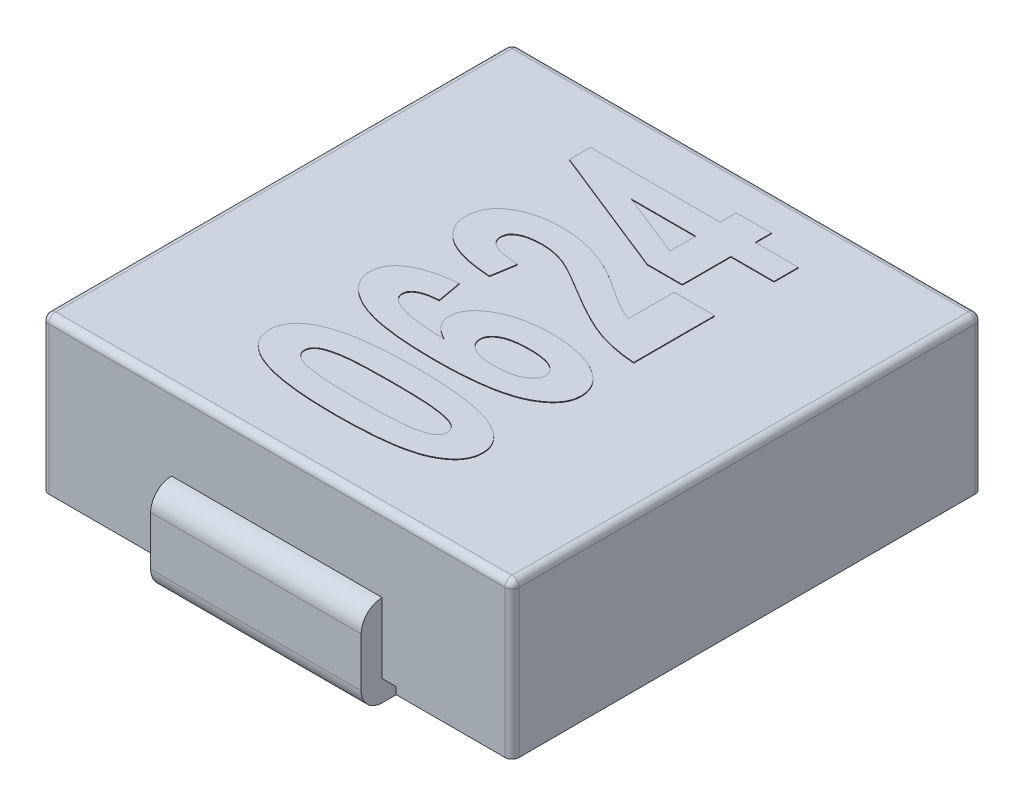
from build123d import *

# Parameters (mm, degrees)
EXTRUDE_1_DEPTH     = 2.2
SKETCH_2_W          = 3.4
SKETCH_2_H          = 2
CUT_EXTRUDE_1_DEPTH = 0.1
EXTRUDE_START       = -1.5
EXTRUDE_1_2_DEPTH   = 3
EXTRUDE_2_DEPTH     = 3
FILLET_1_R          = 0.1
EXTRUDE_2_2_DEPTH   = 0.01


# Read off the part's stored shape, not the designer's step: Вытянуть-Тонкостенный1, Вытянуть-Тонкостенный2
with BuildPart() as part:
    # Эскиз1 → Extrude 1 (new body)
    with BuildSketch(Plane(origin=(0, 0, 0), x_dir=(1, 0, 0), z_dir=(0, 1, 0))):
        with BuildLine():
            Line((-3.25, -3.35), (3.25, -3.35))
            ThreePointArc((3.25, -3.35), (3.320710678, -3.320710678), (3.35, -3.25))
            Line((3.35, -3.25), (3.35, 3.25))
            ThreePointArc((3.35, 3.25), (3.320710678, 3.320710678), (3.25, 3.35))
            Line((3.25, 3.35), (-3.25, 3.35))
            ThreePointArc((-3.25, 3.35), (-3.320710678, 3.320710678), (-3.35, 3.25))
            Line((-3.35, 3.25), (-3.35, -3.25))
            ThreePointArc((-3.35, -3.25), (-3.320710678, -3.320710678), (-3.25, -3.35))
        make_face()
    extrude(amount=EXTRUDE_1_DEPTH)

    # Эскиз2 → Вырез-Вытянуть1 (cut)
    with BuildSketch(Plane.XZ):
        with Locations((0, 2.35)):
            Rectangle(SKETCH_2_W, SKETCH_2_H)
        with Locations((0, -2.35)):
            Rectangle(SKETCH_2_W, SKETCH_2_H)
    extrude(amount=-CUT_EXTRUDE_1_DEPTH, mode=Mode.SUBTRACT)

    # Extrude 1 2 outline → Extrude 1 2 (add)
    with BuildSketch(Plane(origin=(0, 0, 0), x_dir=(0, 0, -1), z_dir=(1, 0, 0)).offset(EXTRUDE_START)):
        with BuildLine():
            Line((-3.35, -0.2), (-1.85, -0.2))
            Line((-1.85, -0.2), (-1.85, 0.1))
            Line((-1.85, 0.1), (-3.35, 0.1))
            Line((-3.35, 0.1), (-3.35, 1.1))
            ThreePointArc((-3.35, 1.1), (-3.562132034, 1.012132034), (-3.65, 0.8))
            Line((-3.65, 0.8), (-3.65, 0.1))
            ThreePointArc((-3.65, 0.1), (-3.562132034, -0.112132034), (-3.35, -0.2))
        make_face()
    extrude(amount=EXTRUDE_1_2_DEPTH)

    # Extrude 2 outline → Extrude 2 (add)
    with BuildSketch(Plane(origin=(0, 0, 0), x_dir=(0, 0, -1), z_dir=(1, 0, 0)).offset(EXTRUDE_START)):
        with BuildLine():
            Line((1.85, 0.1), (1.85, -0.2))
            Line((1.85, -0.2), (3.35, -0.2))
            ThreePointArc((3.35, -0.2), (3.562132034, -0.112132034), (3.65, 0.1))
            Line((3.65, 0.1), (3.65, 0.8))
            ThreePointArc((3.65, 0.8), (3.562132034, 1.012132034), (3.35, 1.1))
            Line((3.35, 1.1), (3.35, 0.1))
            Line((3.35, 0.1), (1.85, 0.1))
        make_face()
    extrude(amount=EXTRUDE_2_DEPTH)

    # Скругление1
    fillet_1_edges = [part.edges().sort_by_distance(p)[0] for p in [
        (3.320710678, 2.2, 3.320710678),
        (3.35, 2.2, 0),
        (3.320710678, 2.2, -3.320710678),
        (0, 2.2, -3.35),
        (-3.320710678, 2.2, -3.320710678),
        (-3.35, 2.2, 0),
        (-3.320710678, 2.2, 3.320710678),
        (0, 2.2, 3.35),
    ]]
    fillet(fillet_1_edges, radius=FILLET_1_R)

    # Эскиз4 → Extrude 2 2 (add)
    # profile 1 of 4: a face of its own
    with BuildSketch(Plane(origin=(0, 2.2, 0), x_dir=(1, 0, 0), z_dir=(0, 1, 0))):
        with BuildLine():
            add(Edge.make_bspline(
                [(-1.5, -1.957692308), (-1.499137143, -1.936566876), (-1.497447551, -1.895200382), (-1.482242122, -1.835098379), (-1.458087806, -1.778584119), (-1.423755807, -1.725761979), (-1.379856182, -1.676448664), (-1.325522016, -1.631842814), (-1.26298141, -1.589080556), (-1.216074382, -1.565892222), (-1.191706731, -1.553846154)],
                knots=[0, 0, 0, 0, 0.939629869, 1.83992419, 2.743264454, 3.666481804, 4.633505536, 5.672028627, 6.790646185, 8, 8, 8, 8], degree=3))
            add(Edge.make_bspline(
                [(-1.191706731, -1.553846154), (-1.158904384, -1.53955104), (-1.089763949, -1.509419953), (-0.974752135, -1.475847916), (-0.845845006, -1.445625948), (-0.701374134, -1.422391671), (-0.542246126, -1.402919805), (-0.367938846, -1.39061196), (-0.178780437, -1.381621929), (-0.047688732, -1.381060813), (0.020432692, -1.380769231)],
                knots=[0, 0, 0, 0, 0.695993191, 1.467006985, 2.327867947, 3.272915826, 4.313905632, 5.448135814, 6.673931191, 8, 8, 8, 8], degree=3))
            add(Edge.make_bspline(
                [(0.020432692, -1.380769231), (0.088346822, -1.38142732), (0.219213706, -1.382695421), (0.408266166, -1.390058637), (0.582217851, -1.404033081), (0.741553906, -1.421993189), (0.886013143, -1.446535154), (1.015745714, -1.476191084), (1.131109184, -1.510782717), (1.200752724, -1.540810484), (1.233774038, -1.555048077)],
                knots=[0, 0, 0, 0, 1.320779415, 2.545071084, 3.678366063, 4.713891943, 5.66240021, 6.526117529, 7.301162213, 8, 8, 8, 8], degree=3))
            add(Edge.make_bspline(
                [(1.233774038, -1.555048077), (1.257897503, -1.567159433), (1.304232457, -1.590422224), (1.366586207, -1.632149894), (1.419375705, -1.677271606), (1.462958308, -1.725975571), (1.497291664, -1.778447599), (1.520545201, -1.835248332), (1.53595582, -1.895181056), (1.537614479, -1.936560343), (1.538461538, -1.957692308)],
                knots=[0, 0, 0, 0, 1.209008214, 2.322193053, 3.353572777, 4.313995313, 5.243012364, 6.148517307, 7.054467326, 8, 8, 8, 8], degree=3))
            add(Edge.make_bspline(
                [(1.538461538, -1.957692308), (1.537411817, -1.978827802), (1.535332896, -2.02068559), (1.518925325, -2.081659932), (1.492824036, -2.139688165), (1.455493603, -2.194066787), (1.407742305, -2.245076498), (1.349426407, -2.292430364), (1.280976264, -2.336770497), (1.20193948, -2.378856542), (1.109155229, -2.416617895), (1.000326036, -2.447366483), (0.875989924, -2.475078094), (0.73501802, -2.496736352), (0.57803189, -2.514064356), (0.404573204, -2.525324635), (0.215024127, -2.533630888), (0.083143563, -2.534278123), (0.014423077, -2.534615385)],
                knots=[0, 0, 0, 0, 0.570946305, 1.130730606, 1.695682016, 2.284720325, 2.905752519, 3.57931678, 4.311109974, 5.108472247, 5.997836566, 7.014420583, 8.163245194, 9.441390503, 10.869501499, 12.433562194, 14.141596213, 16, 16, 16, 16], degree=3))
            add(Edge.make_bspline(
                [(0.014423077, -2.534615385), (-0.053091481, -2.533963284), (-0.183359594, -2.532705068), (-0.371596935, -2.525242226), (-0.545219308, -2.51161966), (-0.703981404, -2.492416926), (-0.848231491, -2.469095664), (-0.97745489, -2.439051032), (-1.092651154, -2.404620183), (-1.162292314, -2.374580012), (-1.1953125, -2.360336538)],
                knots=[0, 0, 0, 0, 1.316839064, 2.540817049, 3.673540427, 4.712565747, 5.659351526, 6.521795573, 7.299112968, 8, 8, 8, 8], degree=3))
            add(Edge.make_bspline(
                [(-1.1953125, -2.360336538), (-1.219440057, -2.348228581), (-1.265782873, -2.324972317), (-1.32808256, -2.283199756), (-1.381170251, -2.238132726), (-1.424095116, -2.188901849), (-1.459027623, -2.136872971), (-1.482048346, -2.080111905), (-1.497503564, -2.020209967), (-1.499156079, -1.978826439), (-1.5, -1.957692308)],
                knots=[0, 0, 0, 0, 1.209129629, 2.322426261, 3.353909562, 4.321163245, 5.242735491, 6.14833137, 7.05437237, 8, 8, 8, 8], degree=3))
        make_face()
        with BuildLine():
            add(Edge.make_bspline(
                [(-1, -1.957692308), (-0.999127679, -1.968216797), (-0.997360051, -1.989543107), (-0.98464763, -2.020189646), (-0.963752812, -2.048548502), (-0.934793713, -2.075564705), (-0.894910908, -2.09990752), (-0.842840464, -2.120448699), (-0.778433667, -2.137921563), (-0.731044768, -2.146944568), (-0.705528846, -2.151802885)],
                knots=[0, 0, 0, 0, 0.66053735, 1.338480494, 2.051183008, 2.861689582, 3.811811342, 4.969049189, 6.368024884, 8, 8, 8, 8], degree=3))
            add(Edge.make_bspline(
                [(-0.705528846, -2.151802885), (-0.686111734, -2.154704884), (-0.644159002, -2.160974962), (-0.576454743, -2.168853117), (-0.499229717, -2.1742951), (-0.413125803, -2.180127901), (-0.317716076, -2.183163637), (-0.213360006, -2.186421571), (-0.099564736, -2.188131724), (-0.020633397, -2.188348668), (0.020432692, -2.188461538)],
                knots=[0, 0, 0, 0, 0.647628605, 1.399270384, 2.247685976, 3.201110699, 4.24594481, 5.39623077, 6.6453211, 8, 8, 8, 8], degree=3))
            add(Edge.make_bspline(
                [(0.020432692, -2.188461538), (0.061297689, -2.188275136), (0.13962396, -2.187917856), (0.252024839, -2.187185067), (0.354384455, -2.183885271), (0.446927652, -2.18023517), (0.529543314, -2.176665945), (0.602017058, -2.17022466), (0.664624604, -2.164110466), (0.732465088, -2.153898049), (0.803572683, -2.140125262), (0.875380999, -2.120604957), (0.93178471, -2.099804879), (0.973513657, -2.07550215), (1.002243275, -2.048087616), (1.023951014, -2.020532594), (1.035633028, -1.989383166), (1.037524767, -1.968187963), (1.038461538, -1.957692308)],
                knots=[0, 0, 0, 0, 1.772229522, 3.396846643, 4.874325468, 6.213183949, 7.413572011, 8.459660885, 9.368179202, 10.14095794, 11.434081607, 12.506883432, 13.365124891, 14.035567992, 14.582591736, 15.079517174, 15.544185971, 16, 16, 16, 16], degree=3))
            add(Edge.make_bspline(
                [(1.038461538, -1.957692308), (1.037650183, -1.946944638), (1.036035603, -1.925557014), (1.022740293, -1.895014588), (1.002646122, -1.866265058), (0.972969063, -1.83991199), (0.933432472, -1.815419158), (0.881280735, -1.794956445), (0.816902053, -1.777456443), (0.769508703, -1.768437735), (0.743990385, -1.763581731)],
                knots=[0, 0, 0, 0, 0.672803919, 1.338864841, 2.061605897, 2.863308736, 3.813131099, 4.970004284, 6.368539142, 8, 8, 8, 8], degree=3))
            add(Edge.make_bspline(
                [(0.743990385, -1.763581731), (0.724572687, -1.760684675), (0.682815507, -1.754454644), (0.615519911, -1.746519364), (0.538893118, -1.741091016), (0.453191294, -1.735236285), (0.357980214, -1.732225337), (0.253624515, -1.728961702), (0.140029441, -1.727256369), (0.061298449, -1.727036962), (0.020432692, -1.726923077)],
                knots=[0, 0, 0, 0, 0.649769229, 1.397309303, 2.24191953, 3.191878681, 4.240166309, 5.394254338, 6.647473319, 8, 8, 8, 8], degree=3))
            add(Edge.make_bspline(
                [(0.020432692, -1.726923077), (-0.020432322, -1.727108707), (-0.098758626, -1.727464505), (-0.211359517, -1.728208719), (-0.313919908, -1.731488821), (-0.40666384, -1.735142837), (-0.489476366, -1.73875147), (-0.562156311, -1.745124382), (-0.62496015, -1.751282622), (-0.692610398, -1.761433922), (-0.763505543, -1.775316331), (-0.835258867, -1.79490132), (-0.892136546, -1.815562221), (-0.934274946, -1.839978234), (-0.963909922, -1.866874521), (-0.98462943, -1.895212168), (-0.997364372, -1.925837425), (-0.999129107, -1.947166469), (-1, -1.957692308)],
                knots=[0, 0, 0, 0, 1.769047239, 3.390747135, 4.874240912, 6.210695287, 7.408927887, 8.461780351, 9.368667298, 10.140058405, 11.422355672, 12.493231132, 13.358012728, 14.034682899, 14.587091034, 15.078019327, 15.545004449, 16, 16, 16, 16], degree=3))
        make_face(mode=Mode.SUBTRACT)
    # profile 2 of 4: a face of its own
    with BuildSketch(Plane(origin=(0, 2.2, 0), x_dir=(1, 0, 0), z_dir=(0, 1, 0))):
        with BuildLine():
            Line((-0.716947115, -0.034615385), (-0.653846154, -0.380769231))
            add(Edge.make_bspline(
                [(-0.653846154, -0.380769231), (-0.681547205, -0.382889175), (-0.733200789, -0.386842193), (-0.804831062, -0.399473341), (-0.865288637, -0.416090973), (-0.914169487, -0.438291327), (-0.952438737, -0.464341137), (-0.979725566, -0.494738618), (-0.996995203, -0.529605986), (-0.99898864, -0.554458508), (-1, -0.567067308)],
                knots=[0, 0, 0, 0, 1.549919711, 2.8901037, 4.054353795, 5.039938989, 5.874463713, 6.61920834, 7.299462416, 8, 8, 8, 8], degree=3))
            add(Edge.make_bspline(
                [(-1, -0.567067308), (-0.999654476, -0.575566657), (-0.99896188, -0.592603468), (-0.98950017, -0.617077399), (-0.976354433, -0.640877904), (-0.957197105, -0.663312067), (-0.932677568, -0.684107646), (-0.903627614, -0.704983619), (-0.868638664, -0.723635404), (-0.827958571, -0.742415177), (-0.778668125, -0.759259885), (-0.719275561, -0.774771817), (-0.648460203, -0.787425798), (-0.566873386, -0.799268821), (-0.474338721, -0.810310047), (-0.370650905, -0.818109574), (-0.255880051, -0.825624574), (-0.17549124, -0.828686016), (-0.133413462, -0.830288462)],
                knots=[0, 0, 0, 0, 0.421598826, 0.845088239, 1.292540369, 1.774895999, 2.30602329, 2.893820393, 3.555766604, 4.280231038, 5.127209864, 6.150050241, 7.339703188, 8.713347625, 10.262722907, 11.9871774, 13.89957508, 16, 16, 16, 16], degree=3))
            add(Edge.make_bspline(
                [(-0.133413462, -0.830288462), (-0.153226041, -0.819580375), (-0.19108179, -0.799120512), (-0.242718247, -0.764788806), (-0.286608857, -0.728348218), (-0.321502927, -0.688749083), (-0.350077859, -0.648240126), (-0.370205963, -0.605180581), (-0.381933675, -0.559868017), (-0.383717932, -0.529071749), (-0.384615385, -0.513581731)],
                knots=[0, 0, 0, 0, 1.267157945, 2.421149296, 3.485202224, 4.467489562, 5.383884497, 6.266713326, 7.128185226, 8, 8, 8, 8], degree=3))
            add(Edge.make_bspline(
                [(-0.384615385, -0.513581731), (-0.383753764, -0.496092925), (-0.382039735, -0.461302267), (-0.369774534, -0.40992183), (-0.348123112, -0.360966415), (-0.319073969, -0.313802855), (-0.28172485, -0.268656146), (-0.23557482, -0.226326612), (-0.181677232, -0.185291033), (-0.12020114, -0.146556207), (-0.052015436, -0.111758018), (0.020926011, -0.079830438), (0.099461039, -0.054651517), (0.182180379, -0.032638342), (0.270071765, -0.016824283), (0.362307799, -0.004782102), (0.459617513, 0.002554479), (0.526028935, 0.003408212), (0.560096154, 0.003846154)],
                knots=[0, 0, 0, 0, 0.712118958, 1.416625472, 2.136553801, 2.883795801, 3.66624321, 4.51480892, 5.428643096, 6.422356621, 7.469656695, 8.544188354, 9.661363121, 10.824973369, 12.028350145, 13.295373735, 14.612601657, 16, 16, 16, 16], degree=3))
            add(Edge.make_bspline(
                [(0.560096154, 0.003846154), (0.596168309, 0.003421893), (0.666384952, 0.002596043), (0.769063955, -0.004896221), (0.866298056, -0.016328939), (0.957852718, -0.034227442), (1.044263907, -0.05525344), (1.124753742, -0.082731392), (1.200519276, -0.113530758), (1.26974538, -0.150376182), (1.332843965, -0.189815334), (1.38725083, -0.23361695), (1.434194106, -0.279210116), (1.472474655, -0.328003059), (1.501748007, -0.38000015), (1.523067826, -0.434539702), (1.53609788, -0.492139584), (1.537668448, -0.531544161), (1.538461538, -0.551442308)],
                knots=[0, 0, 0, 0, 1.39498986, 2.71543254, 3.980142828, 5.179086445, 6.321625476, 7.416841902, 8.465806243, 9.481271331, 10.446328925, 11.339337795, 12.177594524, 12.972664813, 13.729001214, 14.477197864, 15.231029898, 16, 16, 16, 16], degree=3))
            add(Edge.make_bspline(
                [(1.538461538, -0.551442308), (1.537427146, -0.572777842), (1.535366803, -0.615274755), (1.518481686, -0.677481166), (1.490480293, -0.736422249), (1.45069746, -0.791763062), (1.401339194, -0.844850442), (1.340291423, -0.894127013), (1.268586086, -0.940394461), (1.186011794, -0.984335233), (1.090810257, -1.024609906), (0.981459802, -1.05696177), (0.859116341, -1.087065691), (0.722201649, -1.109467722), (0.571499521, -1.128453191), (0.406581412, -1.139980044), (0.228067882, -1.149182415), (0.104381233, -1.149720874), (0.040264423, -1.15)],
                knots=[0, 0, 0, 0, 0.582864578, 1.16097142, 1.749167969, 2.358718482, 3.017750106, 3.726302687, 4.498298734, 5.348834351, 6.281956375, 7.320036994, 8.464218828, 9.726176242, 11.111856478, 12.61750766, 14.246580185, 16, 16, 16, 16], degree=3))
            add(Edge.make_bspline(
                [(0.040264423, -1.15), (-0.025447276, -1.149345796), (-0.152311215, -1.148082781), (-0.335546367, -1.140643622), (-0.504560877, -1.126987543), (-0.659125219, -1.10779629), (-0.799750296, -1.084409689), (-0.926046606, -1.054514414), (-1.038405685, -1.019590677), (-1.136586221, -0.978467516), (-1.221972319, -0.933227902), (-1.296065858, -0.884767436), (-1.358167243, -0.832084508), (-1.410522361, -0.777569442), (-1.450234722, -0.718215697), (-1.478642787, -0.655712732), (-1.497291946, -0.589966759), (-1.49909323, -0.544754917), (-1.5, -0.521995192)],
                knots=[0, 0, 0, 0, 1.739098909, 3.357529062, 4.85223663, 6.225247106, 7.478570524, 8.623010299, 9.657512328, 10.588950926, 11.435634555, 12.211994303, 12.92677536, 13.586936376, 14.20596628, 14.806185805, 15.399031722, 16, 16, 16, 16], degree=3))
            add(Edge.make_bspline(
                [(-1.5, -0.521995192), (-1.499509835, -0.505912065), (-1.498544734, -0.474245452), (-1.48823713, -0.428027115), (-1.472908661, -0.383689243), (-1.45008245, -0.342235737), (-1.422204146, -0.30221565), (-1.386808754, -0.265294978), (-1.345917612, -0.229675703), (-1.298656162, -0.196710911), (-1.245690419, -0.165926024), (-1.186493628, -0.138726176), (-1.122305644, -0.113139062), (-1.051964992, -0.091975207), (-0.976507625, -0.072427191), (-0.894885635, -0.057345975), (-0.807953117, -0.043816558), (-0.74783237, -0.037738042), (-0.716947115, -0.034615385)],
                knots=[0, 0, 0, 0, 0.76381956, 1.50391014, 2.242342492, 2.988420858, 3.747230929, 4.55625529, 5.414143539, 6.323616016, 7.292829522, 8.324445395, 9.419800476, 10.577190305, 11.815979938, 13.12605627, 14.523596504, 16, 16, 16, 16], degree=3))
        make_face()
        with BuildLine():
            add(Edge.make_bspline(
                [(0.546875, -0.803846154), (0.583979099, -0.802982954), (0.653869542, -0.801357004), (0.752205069, -0.787904535), (0.837302066, -0.764872177), (0.908736182, -0.732952461), (0.964873214, -0.693863458), (1.006703356, -0.652463235), (1.033893336, -0.606715693), (1.036965076, -0.573993964), (1.038461538, -0.558052885)],
                knots=[0, 0, 0, 0, 1.487550157, 2.801996091, 3.96948146, 5.011955507, 5.923443518, 6.696061968, 7.364759143, 8, 8, 8, 8], degree=3))
            add(Edge.make_bspline(
                [(1.038461538, -0.558052885), (1.037247589, -0.542975729), (1.034821752, -0.512847031), (1.01275913, -0.470990618), (0.979139196, -0.433336895), (0.940843155, -0.407605158), (0.904366542, -0.388787238), (0.871658869, -0.37638195), (0.834963082, -0.36540953), (0.793808605, -0.357538593), (0.748802939, -0.349978418), (0.699405743, -0.345359083), (0.645851915, -0.343266067), (0.608775561, -0.342635026), (0.589543269, -0.342307692)],
                knots=[0, 0, 0, 0, 0.98415851, 1.96664515, 3.038345339, 4.2755351, 4.969759699, 5.731949388, 6.568604871, 7.481899529, 8.481065577, 9.564888458, 10.736856013, 12, 12, 12, 12], degree=3))
            add(Edge.make_bspline(
                [(0.589543269, -0.342307692), (0.569708839, -0.342582964), (0.531418978, -0.343114368), (0.476051528, -0.345911797), (0.424928736, -0.351378852), (0.377810294, -0.358615233), (0.33470023, -0.367193062), (0.295721336, -0.378754893), (0.260906126, -0.392429778), (0.221493613, -0.412585751), (0.180059321, -0.440438597), (0.143547098, -0.480900385), (0.119316595, -0.526029455), (0.11669742, -0.558569706), (0.115384615, -0.574879808)],
                knots=[0, 0, 0, 0, 1.22920971, 2.372957979, 3.434023047, 4.413685549, 5.326664308, 6.15541423, 6.929955182, 7.640580054, 8.897558011, 9.996505919, 10.995791649, 12, 12, 12, 12], degree=3))
            add(Edge.make_bspline(
                [(0.115384615, -0.574879808), (0.116603075, -0.590534425), (0.119054708, -0.622032703), (0.141364485, -0.666457866), (0.177501245, -0.705244394), (0.225416305, -0.741153975), (0.287618906, -0.769565278), (0.36277845, -0.789326477), (0.45050488, -0.801900588), (0.513373049, -0.803169801), (0.546875, -0.803846154)],
                knots=[0, 0, 0, 0, 0.695405127, 1.39920786, 2.165432477, 3.046964329, 4.054821068, 5.195738149, 6.505630974, 8, 8, 8, 8], degree=3))
        make_face(mode=Mode.SUBTRACT)
    # profile 3 of 4: a face of its own
    with BuildSketch(Plane(origin=(0, 2.2, 0), x_dir=(1, 0, 0), z_dir=(0, 1, 0))):
        with BuildLine():
            Line((0.923076923, 1.388461538), (1.5, 1.388461538))
            Line((1.5, 1.388461538), (1.5, 0.234615385))
            add(Edge.make_bspline(
                [(1.5, 0.234615385), (1.450853252, 0.238584068), (1.353373651, 0.24645571), (1.209518342, 0.269385657), (1.069824563, 0.302382751), (0.954775219, 0.336137462), (0.861831581, 0.370848815), (0.786577951, 0.402134359), (0.706311018, 0.439469424), (0.620644325, 0.482728027), (0.528862356, 0.530238691), (0.432243633, 0.584796257), (0.329998682, 0.644178513), (0.260542889, 0.686413714), (0.224759615, 0.708173077)],
                knots=[0, 0, 0, 0, 1.289104735, 2.556861274, 3.804708595, 5.041066993, 5.689154205, 6.398382692, 7.171855468, 8.003542895, 8.908005236, 9.874257051, 10.90482796, 12, 12, 12, 12], degree=3))
            add(Edge.make_bspline(
                [(0.224759615, 0.708173077), (0.196100865, 0.725378657), (0.141404786, 0.758216019), (0.063286072, 0.805580741), (-0.008057021, 0.846667285), (-0.071927573, 0.883149313), (-0.128850398, 0.913791061), (-0.178890604, 0.93892627), (-0.221288367, 0.959811216), (-0.247743986, 0.97071025), (-0.259615385, 0.975600962)],
                knots=[0, 0, 0, 0, 1.448700748, 2.764888605, 3.959120297, 5.01657917, 5.952674831, 6.760260168, 7.443692973, 8, 8, 8, 8], degree=3))
            add(Edge.make_bspline(
                [(-0.259615385, 0.975600962), (-0.288681493, 0.986021872), (-0.345673023, 1.00645473), (-0.43321846, 1.026390473), (-0.519810482, 1.039883117), (-0.577674092, 1.041503902), (-0.606370192, 1.042307692)],
                knots=[0, 0, 0, 0, 1.042928232, 2.044927184, 3.030427494, 4, 4, 4, 4], degree=3))
            add(Edge.make_bspline(
                [(-0.606370192, 1.042307692), (-0.636254845, 1.041677886), (-0.692414055, 1.040494355), (-0.771350698, 1.030240021), (-0.839754634, 1.014277681), (-0.897016986, 0.990451322), (-0.942438747, 0.96045399), (-0.976422156, 0.92487946), (-0.996082239, 0.881993633), (-0.998682302, 0.85158753), (-1, 0.836177885)],
                knots=[0, 0, 0, 0, 1.458031234, 2.739930902, 3.878203939, 4.877043568, 5.750258799, 6.518463336, 7.249165373, 8, 8, 8, 8], degree=3))
            add(Edge.make_bspline(
                [(-1, 0.836177885), (-0.998749858, 0.820936016), (-0.996253168, 0.79049611), (-0.974877469, 0.747706846), (-0.939320842, 0.711970016), (-0.901140248, 0.686841633), (-0.863713778, 0.669995558), (-0.830181417, 0.658021335), (-0.792095297, 0.648119949), (-0.75004508, 0.63893251), (-0.703434064, 0.632028553), (-0.65255721, 0.625884646), (-0.596997571, 0.621888532), (-0.558497777, 0.620140492), (-0.538461538, 0.619230769)],
                knots=[0, 0, 0, 0, 0.977985299, 1.953158208, 3.002652506, 4.194234773, 4.875468122, 5.642662911, 6.484547082, 7.408173722, 8.41360214, 9.517816347, 10.70821063, 12, 12, 12, 12], degree=3))
            Line((-0.538461538, 0.619230769), (-0.594951923, 0.273076923))
            add(Edge.make_bspline(
                [(-0.594951923, 0.273076923), (-0.633844836, 0.275955802), (-0.708969474, 0.281516576), (-0.817231505, 0.294853732), (-0.917046334, 0.311197909), (-1.008384911, 0.332265098), (-1.091185148, 0.357199547), (-1.16556596, 0.386062877), (-1.231734225, 0.418220996), (-1.289081189, 0.455163597), (-1.338992237, 0.495126664), (-1.381615407, 0.537901363), (-1.418282253, 0.582554002), (-1.447987042, 0.630066472), (-1.471714803, 0.679751055), (-1.487782607, 0.732447668), (-1.498631252, 0.787051923), (-1.499541219, 0.824506037), (-1.5, 0.843389423)],
                knots=[0, 0, 0, 0, 1.579560095, 3.051041266, 4.417077792, 5.674853277, 6.845369828, 7.916761964, 8.903834858, 9.819948492, 10.674094803, 11.488866127, 12.261919774, 13.009380386, 13.753530217, 14.484962415, 15.236157608, 16, 16, 16, 16], degree=3))
            add(Edge.make_bspline(
                [(-1.5, 0.843389423), (-1.499307756, 0.864062862), (-1.497946987, 0.904701367), (-1.487232218, 0.963912062), (-1.46799251, 1.019210304), (-1.442749146, 1.071646754), (-1.409529841, 1.120435872), (-1.368448314, 1.165218455), (-1.320795913, 1.20692188), (-1.265929318, 1.24424351), (-1.206170002, 1.278481138), (-1.141889113, 1.307759421), (-1.07398878, 1.33217558), (-1.003203375, 1.353764665), (-0.928265735, 1.36883928), (-0.850065212, 1.380477026), (-0.768138086, 1.386967668), (-0.712350252, 1.387956937), (-0.683894231, 1.388461538)],
                knots=[0, 0, 0, 0, 0.907189765, 1.783294833, 2.628589816, 3.470126486, 4.331009267, 5.208745366, 6.131021837, 7.104202236, 8.116286935, 9.151072103, 10.199772534, 11.28199686, 12.396008899, 13.551211837, 14.750932554, 16, 16, 16, 16], degree=3))
            add(Edge.make_bspline(
                [(-0.683894231, 1.388461538), (-0.65122476, 1.388065403), (-0.586590807, 1.387281679), (-0.490916785, 1.379053703), (-0.397622497, 1.36658273), (-0.305918667, 1.348973116), (-0.214411693, 1.325942809), (-0.121632449, 1.296767791), (-0.026653447, 1.262138403), (0.036392762, 1.234746956), (0.068509615, 1.220793269)],
                knots=[0, 0, 0, 0, 1.008927202, 1.996082299, 2.963965572, 3.915410391, 4.87891233, 5.8770608, 6.918537254, 8, 8, 8, 8], degree=3))
            add(Edge.make_bspline(
                [(0.068509615, 1.220793269), (0.079953856, 1.215439544), (0.104219495, 1.204087848), (0.142221579, 1.184872481), (0.183287061, 1.161690056), (0.228941295, 1.136846409), (0.276968434, 1.106884042), (0.32961817, 1.075548968), (0.384820808, 1.03950681), (0.442559601, 1.002324755), (0.499638775, 0.965243668), (0.552739803, 0.930507961), (0.600819697, 0.899530118), (0.644382713, 0.873484453), (0.681846079, 0.849796457), (0.714585637, 0.830498295), (0.742166312, 0.814737589), (0.784970102, 0.792322095), (0.844051566, 0.764694641), (0.897282899, 0.74564773), (0.923076923, 0.736418269)],
                knots=[0, 0, 0, 0, 0.693052831, 1.46950505, 2.335080331, 3.279634318, 4.319881199, 5.439295331, 6.640251146, 7.935623074, 9.206576243, 10.373882287, 11.416390135, 12.343591259, 13.157770686, 13.847505367, 14.428124923, 14.899986278, 16.497842864, 18, 18, 18, 18], degree=3))
            Line((0.923076923, 0.736418269), (0.923076923, 1.388461538))
        make_face()
    # profile 4 of 4: a face of its own
    with BuildSketch(Plane(origin=(0, 2.2, 0), x_dir=(1, 0, 0), z_dir=(0, 1, 0))):
        Polygon((1.5, 2.234615385), (0.884615385, 2.234615385), (0.884615385, 1.542307692), (0.386418269, 1.542307692), (-1.461538462, 2.280288462), (-1.461538462, 2.580769231), (0.384615385, 2.580769231), (0.384615385, 2.811538462), (0.884615385, 2.811538462), (0.884615385, 2.580769231), (1.5, 2.580769231), align=None)
        Polygon((0.384615385, 2.234615385), (-0.538461538, 2.234615385), (0.384615385, 1.865625), align=None, mode=Mode.SUBTRACT)
    extrude(amount=EXTRUDE_2_2_DEPTH)


solid = part.part
